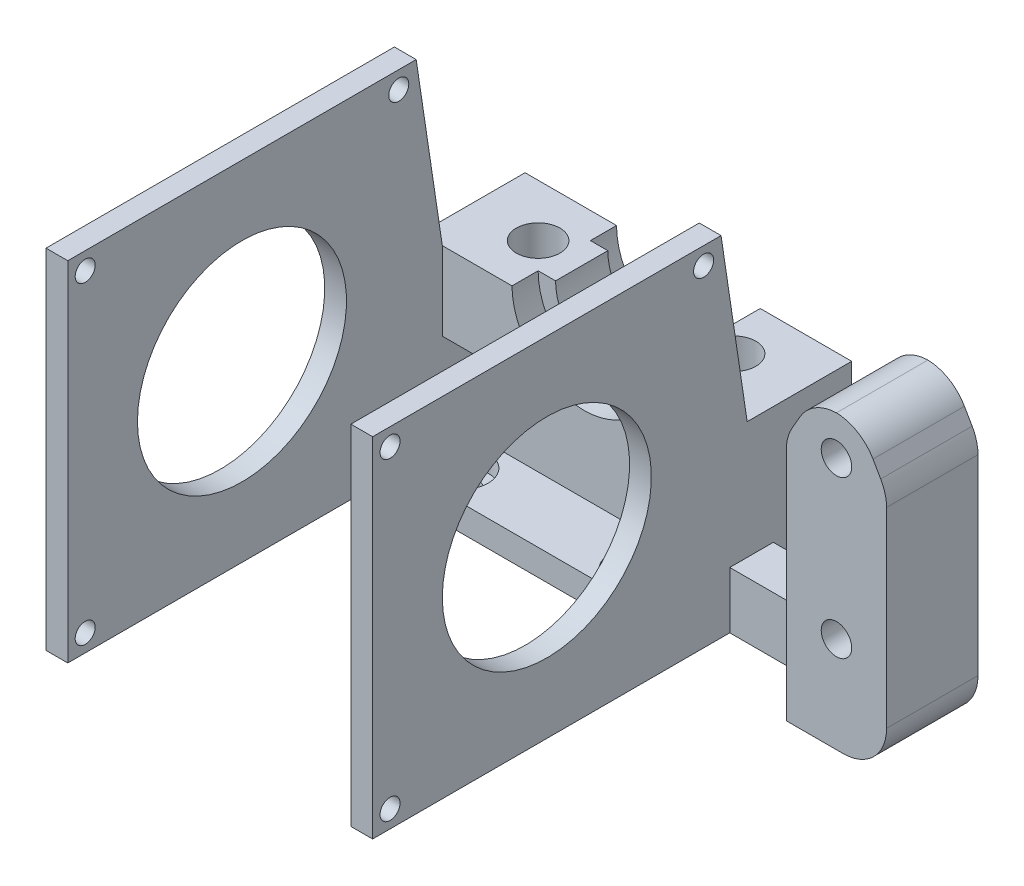
from build123d import *

# Parameters (mm, degrees)
SKETCH1_W                       = 45
SKETCH1_H                       = 27
BOSS_EXTRUDE1_DEPTH             = 3
CUT_EXTRUDE1_REACH              = 28.41
SKETCH2_R                       = 1.75
SKETCH3_R                       = 3
CUT_EXTRUDE2_DEPTH              = 2
BOSS_EXTRUDE2_DEPTH             = 6
CUT_EXTRUDE6_REACH              = 37.992
CUT_EXTRUDE6_START              = -3
SKETCH12_R                      = 8.25
SKETCH15_R                      = 2.5
CUT_EXTRUDE7_DEPTH              = 6
SKETCH16_R                      = 1.15
SKETCH16_R_2                    = 12
BOSS_EXTRUDE5_DEPTH             = 2.5
CUT_EXTRUDE8_START              = -3.75
SKETCH17_W                      = 5.5
SKETCH17_H                      = 3
CUT_EXTRUDE8_DEPTH              = 82.37731478
BOSS_EXTRUDE6_START             = -9
SKETCH18_R                      = 1.75
BOSS_EXTRUDE6_DEPTH             = 5
SKETCH21_W                      = 11.5
SKETCH21_H                      = 33.5
SKETCH21_R                      = 1.75
BOSS_EXTRUDE7_DEPTH             = 5.5
CUT_EXTRUDE9_DEPTH              = 2
CHAMFER1_SIZE                   = 3
CHAMFER1_SIZE2                  = 5.196152423
FILLET1_R                       = 5
CUT_EXTRUDE10_REACH             = 74.347
SKETCH20_W                      = 4
SKETCH20_H                      = 8
CUT_EXTRUDE10_DIRECTION_2_DEPTH = 73.346820939
CHAMFER2_SIZE2                  = 3
CHAMFER2_SIZE                   = 20
CHAMFER3_SIZE2                  = 20
CHAMFER3_SIZE                   = 3


# Some blends are built 0.0001 mm under size
with BuildPart() as part:
    # Sketch1 → Boss-Extrude1 (new body)
    with BuildSketch(Plane(origin=(0, 0, 0), x_dir=(1, 0, 0), z_dir=(0, 1, 0))):
        Rectangle(SKETCH1_W, SKETCH1_H)
    extrude(amount=BOSS_EXTRUDE1_DEPTH)

    # Sketch2 → Cut-Extrude1 (cut, up to next)
    with BuildSketch(Plane(origin=(0, 3, 0), x_dir=(1, 0, 0), z_dir=(0, 1, 0)), mode=Mode.PRIVATE) as cut_extrude1_sk1:
        with Locations(Location((-10, 10, 0), (0, 0, 270))):
            Circle(SKETCH2_R)
    cut_extrude1_tool1 = extrude(cut_extrude1_sk1.sketch, amount=-CUT_EXTRUDE1_REACH, mode=Mode.PRIVATE) & part.part
    # Sketch2 → Cut-Extrude1 (cut, up to next)
    with BuildSketch(Plane(origin=(0, 3, 0), x_dir=(1, 0, 0), z_dir=(0, 1, 0)), mode=Mode.PRIVATE) as cut_extrude1_sk2:
        with Locations(Location((10, 10, 0), (0, 0, 270))):
            Circle(SKETCH2_R)
    cut_extrude1_tool2 = extrude(cut_extrude1_sk2.sketch, amount=-CUT_EXTRUDE1_REACH, mode=Mode.PRIVATE) & part.part
    # Sketch2 → Cut-Extrude1 (cut, up to next)
    with BuildSketch(Plane(origin=(0, 3, 0), x_dir=(1, 0, 0), z_dir=(0, 1, 0)), mode=Mode.PRIVATE) as cut_extrude1_sk3:
        with Locations(Location((10, -10, 0), (0, 0, 270))):
            Circle(SKETCH2_R)
    cut_extrude1_tool3 = extrude(cut_extrude1_sk3.sketch, amount=-CUT_EXTRUDE1_REACH, mode=Mode.PRIVATE) & part.part
    # Sketch2 → Cut-Extrude1 (cut, up to next)
    with BuildSketch(Plane(origin=(0, 3, 0), x_dir=(1, 0, 0), z_dir=(0, 1, 0)), mode=Mode.PRIVATE) as cut_extrude1_sk4:
        with Locations(Location((-10, -10, 0), (0, 0, 270))):
            Circle(SKETCH2_R)
    cut_extrude1_tool4 = extrude(cut_extrude1_sk4.sketch, amount=-CUT_EXTRUDE1_REACH, mode=Mode.PRIVATE) & part.part
    add(cut_extrude1_tool1.solids().sort_by_distance((-10, 3, -10))[0], mode=Mode.SUBTRACT)
    add(cut_extrude1_tool2.solids().sort_by_distance((10, 3, -10))[0], mode=Mode.SUBTRACT)
    add(cut_extrude1_tool3.solids().sort_by_distance((10, 3, 10))[0], mode=Mode.SUBTRACT)
    add(cut_extrude1_tool4.solids().sort_by_distance((-10, 3, 10))[0], mode=Mode.SUBTRACT)

    # Sketch3 → Cut-Extrude2 (cut)
    with BuildSketch(Plane(origin=(0, 3, 0), x_dir=(1, 0, 0), z_dir=(0, 1, 0))):
        with Locations(Location((-10, 10, 0), (0, 0, 270))):
            Circle(SKETCH3_R)
        with Locations(Location((10, 10, 0), (0, 0, 90))):
            Circle(SKETCH3_R)
        with Locations(Location((10, -10, 0), (0, 0, 270))):
            Circle(SKETCH3_R)
        with Locations(Location((-10, -10, 0), (0, 0, 90))):
            Circle(SKETCH3_R)
    extrude(amount=-CUT_EXTRUDE2_DEPTH, mode=Mode.SUBTRACT)

    # Sketch5 → Boss-Extrude2 (add, symmetric)
    with BuildSketch(Plane.XY):
        with BuildLine():
            Line((16.25, 3), (-16.25, 3))
            Line((-16.25, 3), (-16.25, 20))
            Line((-16.25, 20), (-6.25, 20))
            ThreePointArc((-6.25, 20), (0, 13.75), (6.25, 20))
            Line((6.25, 20), (16.25, 20))
            Line((16.25, 20), (16.25, 3))
        make_face()
    extrude(amount=BOSS_EXTRUDE2_DEPTH, both=True)

    # Sketch12 → Cut-Extrude6 (cut, up to next)
    with BuildSketch(Plane.XY.offset(CUT_EXTRUDE6_START), mode=Mode.PRIVATE) as cut_extrude6_sk1:
        with Locations((0, 20)):
            Circle(SKETCH12_R)
    cut_extrude6_tool1 = extrude(cut_extrude6_sk1.sketch, amount=-CUT_EXTRUDE6_REACH, mode=Mode.PRIVATE) & part.part
    cut_extrude6 = cut_extrude6_tool1.solids().sort_by_distance((0, 20, -3))[0]
    add(cut_extrude6, mode=Mode.SUBTRACT)

    # Mirror1: Cut-Extrude6 across plane
    add(cut_extrude6.mirror(Plane.XY), mode=Mode.SUBTRACT)

    # Sketch15 → Cut-Extrude7 (cut)
    with BuildSketch(Plane(origin=(0, 20, 0), x_dir=(1, 0, 0), z_dir=(0, 1, 0))):
        with Locations(Location((-11.25, 0, 0), (0, 0, 180))):
            Circle(SKETCH15_R)
        with Locations((11.25, 0)):
            Circle(SKETCH15_R)
    extrude(amount=-CUT_EXTRUDE7_DEPTH, mode=Mode.SUBTRACT)

    # Sketch16 → Boss-Extrude5 (add)
    with BuildSketch(Plane.ZY.offset(16.25)):
        Polygon((9, 3), (9, 0), (49, 0), (49, 40), (9, 40), (6, 40), (6, 20), (-6, 20), (-6, 3), align=None)
        with Locations((47, 2)):
            Circle(SKETCH16_R, mode=Mode.SUBTRACT)
        with Locations(Location((47, 38, 0), (0, 0, 180))):
            Circle(SKETCH16_R, mode=Mode.SUBTRACT)
        with Locations(Location((11, 38, 0), (0, 0, 180))):
            Circle(SKETCH16_R, mode=Mode.SUBTRACT)
        with Locations((29, 20)):
            Circle(SKETCH16_R_2, mode=Mode.SUBTRACT)
    boss_extrude5 = extrude(amount=BOSS_EXTRUDE5_DEPTH)

    # Sketch17 → Cut-Extrude8 (cut)
    with BuildSketch(Plane.ZY.offset(22.5).offset(CUT_EXTRUDE8_START)):
        with Locations((10.75, 1.5)):
            Rectangle(SKETCH17_W, SKETCH17_H)
    cut_extrude8 = extrude(amount=CUT_EXTRUDE8_DEPTH, mode=Mode.SUBTRACT)

    # Mirror2: Boss-Extrude5, Cut-Extrude8 across plane
    add(boss_extrude5.mirror(Plane(origin=(0, 0, 0), x_dir=(0, 0, 1), z_dir=(1, 0, 0))))
    add(cut_extrude8.mirror(Plane(origin=(0, 0, 0), x_dir=(0, 0, 1), z_dir=(1, 0, 0))), mode=Mode.SUBTRACT)

    # Sketch18 → Boss-Extrude6 (add)
    with BuildSketch(Plane(origin=(0, 0, -6), x_dir=(-1, 0, 0), z_dir=(0, 0, -1)).offset(BOSS_EXTRUDE6_START)):
        Polygon((-42.25, 33.5), (-30.75, 33.5), (-30.75, 6.5), (-18.75, 6.5), (-18.75, 0), (-42.25, 0), (-42.25, 6.5), align=None)
        with Locations((-36.5, 29)):
            Circle(SKETCH18_R, mode=Mode.SUBTRACT)
        with Locations(Location((-36.5, 11, 0), (0, 0, 180))):
            Circle(SKETCH18_R, mode=Mode.SUBTRACT)
    extrude(amount=-BOSS_EXTRUDE6_DEPTH)

    # Sketch21 → Boss-Extrude7 (add)
    with BuildSketch(Plane.XY.offset(8)):
        with Locations((36.5, 16.75)):
            Rectangle(SKETCH21_W, SKETCH21_H)
        with Locations(Location((36.5, 29, 0), (0, 0, 180))):
            Circle(SKETCH21_R, mode=Mode.SUBTRACT)
        with Locations((36.5, 11)):
            Circle(SKETCH21_R, mode=Mode.SUBTRACT)
    extrude(amount=BOSS_EXTRUDE7_DEPTH)

    # Sketch19 → Cut-Extrude9 (cut)
    with BuildSketch(Plane(origin=(0, 0, 3), x_dir=(-1, 0, 0), z_dir=(0, 0, -1))):
        Polygon((-39.848631561, 11), (-38.174315781, 8.1), (-34.825684219, 8.1), (-33.151368439, 11), (-34.825684219, 13.9), (-38.174315781, 13.9), align=None)
        Polygon((-39.848631561, 29), (-38.174315781, 26.1), (-34.825684219, 26.1), (-33.151368439, 29), (-34.825684219, 31.9), (-38.174315781, 31.9), align=None)
    extrude(amount=-CUT_EXTRUDE9_DEPTH, mode=Mode.SUBTRACT)

    # Chamfer1
    chamfer1_edges = [part.edges().sort_by_distance(p)[0] for p in [
        (42.25, 33.5, 8.25),
        (30.75, 33.5, 8.25),
    ]]
    chamfer1_side = [part.faces().sort_by_distance(p)[0] for p in [
        (36.5, 33.5, 8.25),
    ]]
    chamfer(chamfer1_edges, length=CHAMFER1_SIZE, length2=CHAMFER1_SIZE2, reference=chamfer1_side[0])

    # Fillet1
    # the kernel refuses this fillet: 5 mm, written as the material it takes off along each edge
    with BuildSketch(Plane(origin=(42.25, 0, -9.5), x_dir=(-1, 0, 0), z_dir=(0, 0, 1))) as fillet1_piece_1:
        with BuildLine():
            CenterArc((FILLET1_R, -FILLET1_R), FILLET1_R, 90, 90)
            Line((0, -FILLET1_R), (0, 0))
            Line((0, 0), (FILLET1_R, 0))
        make_face()
    extrude(amount=35.5, mode=Mode.SUBTRACT)
    with BuildSketch(Plane(origin=(42.25, 28.303847577, -0.349364905), x_dir=(-0.4999999999999988, 0.8660254037844394, 0), z_dir=(0, 0, 1))) as fillet1_piece_2:
        with BuildLine():
            CenterArc((FILLET1_R * 0.267949192431, FILLET1_R), FILLET1_R, 240, 30)
            Line((-FILLET1_R * 0.232050807569, FILLET1_R * 0.133974596216), (0, 0))
            Line((0, 0), (FILLET1_R * 0.267949192431, 0))
        make_face()
    extrude(amount=17.198729811, mode=Mode.SUBTRACT)
    with BuildSketch(Plane(origin=(30.75, 28.303847577, 16.849364905), x_dir=(0, -1, 0), z_dir=(0, 0, -1))) as fillet1_piece_3:
        with BuildLine():
            CenterArc((FILLET1_R * 0.267949192431, -FILLET1_R), FILLET1_R, 90, 30)
            Line((-FILLET1_R * 0.232050807569, -FILLET1_R * 0.133974596216), (0, 0))
            Line((0, 0), (FILLET1_R * 0.267949192431, 0))
        make_face()
    extrude(amount=17.198729811, mode=Mode.SUBTRACT)
    with BuildSketch(Plane(origin=(39.25, 33.5, -4.216878365), x_dir=(-1, 0, 0), z_dir=(0, 0, 1))) as fillet1_piece_4:
        with BuildLine():
            CenterArc((FILLET1_R * 0.57735026919, FILLET1_R), FILLET1_R, 210, 60)
            Line((-FILLET1_R * 0.288675134595, FILLET1_R * 0.5), (0, 0))
            Line((0, 0), (FILLET1_R * 0.57735026919, 0))
        make_face()
    extrude(amount=24.93375673, mode=Mode.SUBTRACT)
    with BuildSketch(Plane(origin=(33.75, 33.5, 20.716878365), x_dir=(-0.4999999999999974, -0.86602540378444, 0), z_dir=(0, 0, -1))) as fillet1_piece_5:
        with BuildLine():
            CenterArc((FILLET1_R * 0.57735026919, -FILLET1_R), FILLET1_R, 90, 60)
            Line((-FILLET1_R * 0.288675134595, -FILLET1_R * 0.5), (0, 0))
            Line((0, 0), (FILLET1_R * 0.57735026919, 0))
        make_face()
    extrude(amount=24.93375673, mode=Mode.SUBTRACT)

    # Sketch20 → Cut-Extrude10 (cut, up to next)
    with BuildSketch(Plane.XY.offset(6), mode=Mode.PRIVATE) as cut_extrude10_sk1:
        with Locations((-14.25, 7)):
            Rectangle(SKETCH20_W, SKETCH20_H)
    cut_extrude10_tool1 = extrude(cut_extrude10_sk1.sketch, amount=-CUT_EXTRUDE10_REACH, mode=Mode.PRIVATE) & part.part
    # Sketch20 → Cut-Extrude10 (cut, up to next)
    with BuildSketch(Plane.XY.offset(6), mode=Mode.PRIVATE) as cut_extrude10_sk2:
        with Locations((14.25, 7)):
            Rectangle(SKETCH20_W, SKETCH20_H)
    cut_extrude10_tool2 = extrude(cut_extrude10_sk2.sketch, amount=-CUT_EXTRUDE10_REACH, mode=Mode.PRIVATE) & part.part
    add(cut_extrude10_tool1.solids().sort_by_distance((-14.25, 7, 6))[0], mode=Mode.SUBTRACT)
    add(cut_extrude10_tool2.solids().sort_by_distance((14.25, 7, 6))[0], mode=Mode.SUBTRACT)

    # Sketch20 → Cut-Extrude10 direction 2 (cut)
    with BuildSketch(Plane.XY.offset(6)):
        with Locations((-14.25, 7)):
            Rectangle(SKETCH20_W, SKETCH20_H)
        with Locations((14.25, 7)):
            Rectangle(SKETCH20_W, SKETCH20_H)
    extrude(amount=CUT_EXTRUDE10_DIRECTION_2_DEPTH, mode=Mode.SUBTRACT)

    # Chamfer2
    chamfer2_edges = [part.edges().sort_by_distance(p)[0] for p in [
        (-17.5, 40, 6),
    ]]
    chamfer2_side = [part.faces().sort_by_distance(p)[0] for p in [
        (-17.5, 39.94, 6),
    ]]
    chamfer(chamfer2_edges, length=CHAMFER2_SIZE - 0.0001, length2=CHAMFER2_SIZE2 - 0.0001, reference=chamfer2_side[0])  # a hair under: the kernel refuses the full size

    # Chamfer3
    chamfer3_edges = [part.edges().sort_by_distance(p)[0] for p in [
        (17.5, 40, 6),
    ]]
    chamfer3_side = [part.faces().sort_by_distance(p)[0] for p in [
        (17.5, 40, 6.06),
    ]]
    chamfer(chamfer3_edges, length=CHAMFER3_SIZE - 0.0001, length2=CHAMFER3_SIZE2 - 0.0001, reference=chamfer3_side[0])  # a hair under: the kernel refuses the full size


solid = part.part
